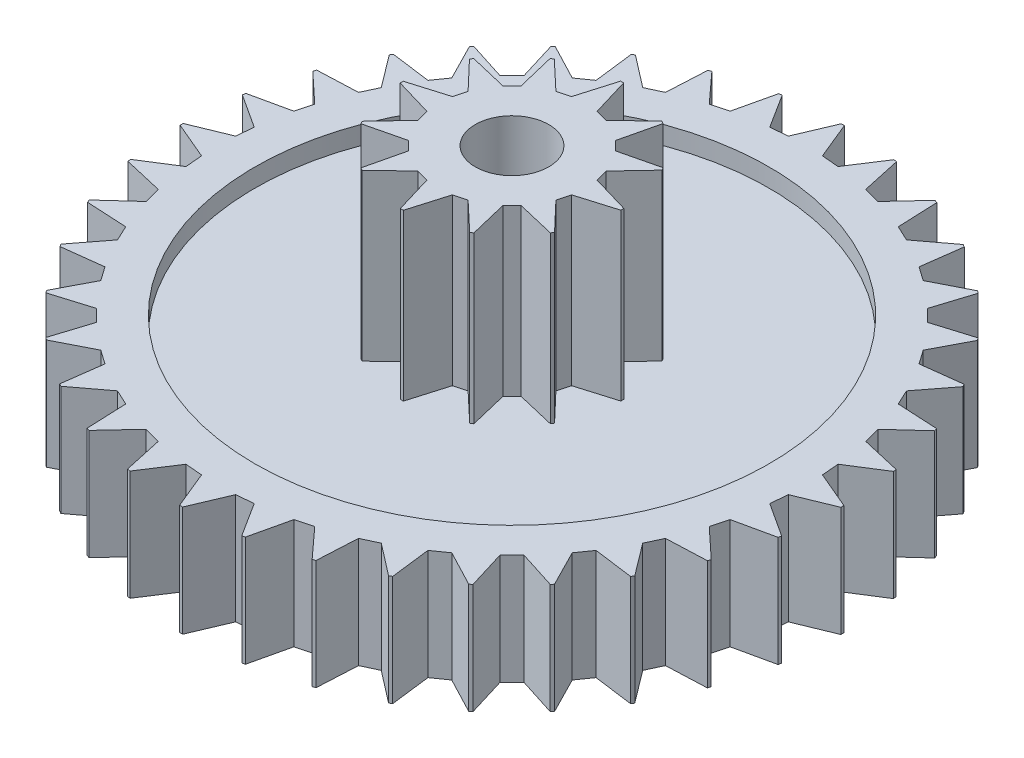
from build123d import *

# Parameters (mm, degrees)
SKETCH2_R           = 4.5
BOSS_EXTRUDE1_DEPTH = 1.5
CUT_EXTRUDE1_DEPTH  = 7.538348415
CIRPATTERN1_COUNT   = 36
SKETCH6_R           = 3.5
CUT_EXTRUDE2_DEPTH  = 0.25
SKETCH7_R           = 0.5
CUT_EXTRUDE3_DEPTH  = 7.538348415
CUT_EXTRUDE4_START  = -0.25
SKETCH8_R           = 3.5
SKETCH8_R_2         = 1
CUT_EXTRUDE4_DEPTH  = 0.25
SKETCH9_R           = 1.5
BOSS_EXTRUDE2_DEPTH = 2.25
SKETCH10_R          = 0.5
CUT_EXTRUDE5_DEPTH  = 8.262919523
CUT_EXTRUDE6_DEPTH  = 2.25
CIRPATTERN2_COUNT   = 12


with BuildPart() as part:
    # Sketch2 → Boss-Extrude1 (new body)
    with BuildSketch(Plane(origin=(0, 0, 0), x_dir=(1, 0, 0), z_dir=(0, 1, 0))):
        Circle(SKETCH2_R)
    extrude(amount=BOSS_EXTRUDE1_DEPTH)

    # Sketch4 → Cut-Extrude1 (cut, through all)
    with BuildSketch(Plane(origin=(0, 1.5, 0), x_dir=(1, 0, 0), z_dir=(0, 1, 0))):
        Polygon((0.232579316, 3.993232633), (0, 4.558789127), (0.788499869, 4.471804974), (0.464371657, 3.972953431), align=None)
    cut_extrude1 = extrude(amount=-CUT_EXTRUDE1_DEPTH, mode=Mode.SUBTRACT)

    # CirPattern1: Cut-Extrude1 ×36 about axis
    cirpattern1_axis = Axis((0, 0, 0), (0, 1, 0))
    for i in range(1, CIRPATTERN1_COUNT):
        add(cut_extrude1.rotate(cirpattern1_axis, i * 360 / CIRPATTERN1_COUNT), mode=Mode.SUBTRACT)

    # Sketch6 → Cut-Extrude2 (cut)
    with BuildSketch(Plane(origin=(0, 1.5, 0), x_dir=(1, 0, 0), z_dir=(0, 1, 0))):
        Circle(SKETCH6_R)
    extrude(amount=-CUT_EXTRUDE2_DEPTH, mode=Mode.SUBTRACT)

    # Sketch7 → Cut-Extrude3 (cut, through all)
    with BuildSketch(Plane(origin=(0, 1.5, 0), x_dir=(1, 0, 0), z_dir=(0, 1, 0))):
        Circle(SKETCH7_R)
    extrude(amount=-CUT_EXTRUDE3_DEPTH, mode=Mode.SUBTRACT)

    # Sketch8 → Cut-Extrude4 (cut)
    with BuildSketch(Plane(origin=(0, 0, 0), x_dir=(-1, 0, 0), z_dir=(0, -1, 0)).offset(CUT_EXTRUDE4_START)):
        Circle(SKETCH8_R)
        Circle(SKETCH8_R_2, mode=Mode.SUBTRACT)
    extrude(amount=CUT_EXTRUDE4_DEPTH, mode=Mode.SUBTRACT)

    # Sketch9 → Boss-Extrude2 (add)
    with BuildSketch(Plane(origin=(0, 1.25, 0), x_dir=(1, 0, 0), z_dir=(0, 1, 0))):
        Circle(SKETCH9_R)
    extrude(amount=BOSS_EXTRUDE2_DEPTH)

    # Sketch10 → Cut-Extrude5 (cut, through all)
    with BuildSketch(Plane(origin=(0, 3.5, 0), x_dir=(1, 0, 0), z_dir=(0, 1, 0))):
        Circle(SKETCH10_R)
    extrude(amount=-CUT_EXTRUDE5_DEPTH, mode=Mode.SUBTRACT)

    # Sketch11 → Cut-Extrude6 (cut)
    with BuildSketch(Plane(origin=(0, 3.5, 0), x_dir=(1, 0, 0), z_dir=(0, 1, 0))):
        Polygon((-0.984807753, 0.173648178), (-1.565317225, 0), (-1.36360311, 0.787276623), (-0.939692621, 0.342020143), align=None)
    cut_extrude6 = extrude(amount=-CUT_EXTRUDE6_DEPTH, mode=Mode.SUBTRACT)

    # CirPattern2: Cut-Extrude6 ×12 about axis
    cirpattern2_axis = Axis((0, 0, 0), (0, 1, 0))
    for i in range(1, CIRPATTERN2_COUNT):
        add(cut_extrude6.rotate(cirpattern2_axis, i * 360 / CIRPATTERN2_COUNT), mode=Mode.SUBTRACT)


solid = part.part
